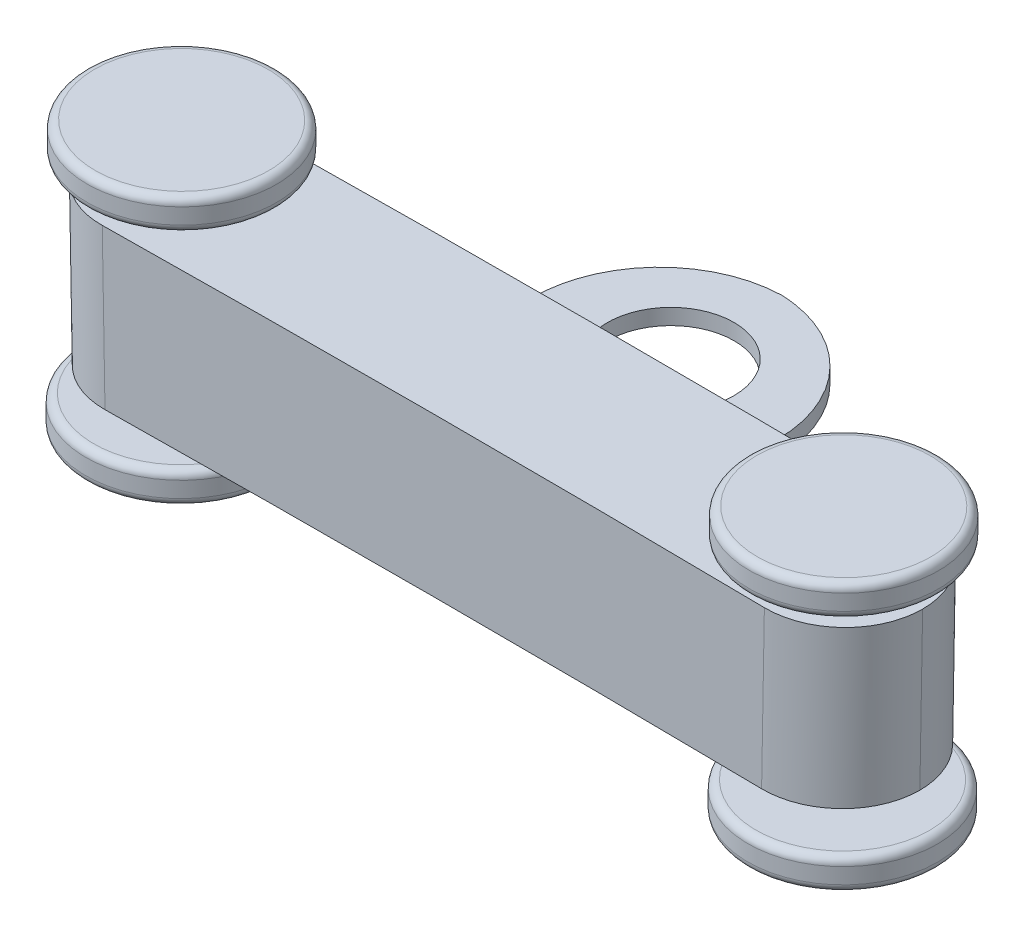
from build123d import *

# Parameters (mm, degrees)
EXTRUDE_1_DEPTH      = 5
FILLET_1_R           = 5
EXTRUDE_2_DEPTH      = 12
FILLET_2_R           = 8
SKETCH_4_R           = 4
CUT_EXTRUDE_1_DEPTH  = 1486.323382692
EXTRUDE_3_DEPTH      = 1
EXTRUDE_3_DEPTH_BACK = 12
SKETCH_5_R           = 2
SKETCH_6_R           = 6
EXTRUDE_4_DEPTH      = 2
EXTRUDE_START        = 2
SKETCH_7_R           = 6
EXTRUDE_5_DEPTH      = 2
FILLET_4_R           = 0.5


# Some blends are built 0.0001 mm under size
with BuildPart() as part:
    # 草图1 → 凸台-拉伸1 (new, symmetric)
    with BuildSketch(Plane.XY):
        with BuildLine():
            Line((-25.742299495, 1474.775350356), (-25.916823559, 1484.773827307))
            ThreePointArc((-25.916823559, 1484.773827307), (0, 1485), (25.916823559, 1484.773827307))
            Line((25.916823559, 1484.773827307), (25.742299495, 1474.775350356))
            ThreePointArc((25.742299495, 1474.775350356), (0, 1475), (-25.742299495, 1474.775350356))
        make_face()
    extrude(amount=EXTRUDE_1_DEPTH, both=True)

    # 圆角1
    fillet_1_edges = [part.edges().sort_by_distance(p)[0] for p in [
        (25.829561527, 1479.774588831, 5),
        (25.829561527, 1479.774588831, -5),
        (-25.829561527, 1479.774588831, 5),
        (-25.829561527, 1479.774588831, -5),
    ]]
    fillet(fillet_1_edges, radius=FILLET_1_R - 0.0001)  # a hair under: the kernel refuses the full size

    # 草图3 → 凸台-拉伸2 (add)
    with BuildSketch(Plane(origin=(0, 0, -5), x_dir=(-1, 0, 0), z_dir=(0, 0, -1))):
        with BuildLine():
            Line((-7.751844452, 1480.479705672), (-7.746608489, 1479.47971938))
            ThreePointArc((-7.746608489, 1479.47971938), (-3.873317518, 1479.494929836), (0, 1479.5))
            Line((0, 1479.5), (0, 1480.5))
            ThreePointArc((0, 1480.5), (-3.875935509, 1480.494926409), (-7.751844452, 1480.479705672))
        make_face()
        with BuildLine():
            Line((0, 1480.5), (0, 1479.5))
            ThreePointArc((0, 1479.5), (3.873317518, 1479.494929836), (7.746608489, 1479.47971938))
            Line((7.746608489, 1479.47971938), (7.751844452, 1480.479705672))
            ThreePointArc((7.751844452, 1480.479705672), (3.875935509, 1480.494926409), (0, 1480.5))
        make_face()
    extrude(amount=EXTRUDE_2_DEPTH)

    # 圆角2
    # the kernel refuses this fillet: 8 mm, written as the material it takes off along each edge
    with BuildSketch(Plane(origin=(-7.641889212, 1459.479993535, -17), x_dir=(0, 0, 1), z_dir=(-0.005235963831420343, 0.9999862922474269, 0)), Plane(origin=(7.856563729, 1500.479431517, -17), x_dir=(0, 0, 1), z_dir=(-0.0052359638314218165, -0.9999862922474269, 0))) as fillet_2_piece_1:
        with BuildLine():
            CenterArc((FILLET_2_R, FILLET_2_R), FILLET_2_R, 180, 90)
            Line((0, FILLET_2_R), (0, 0))
            Line((0, 0), (FILLET_2_R, 0))
        make_face()
    extrude(amount=41, mode=Mode.SUBTRACT)

    # 草图4 → 切除-拉伸1 (cut, through all)
    with BuildSketch(Plane(origin=(0, 0, 0), x_dir=(1, 0, 0), z_dir=(0, 1, 0))):
        with Locations(Location((0, 10, 0), (0, 0, 90))):
            Circle(SKETCH_4_R)
    extrude(amount=CUT_EXTRUDE_1_DEPTH, mode=Mode.SUBTRACT)

    # 草图5 → 凸台-拉伸3 (add, two sides: drawn at the far end of the back side and taken through both)
    with BuildSketch(Plane(origin=(7.77540629, 1484.979643987, 0), x_dir=(0.9999862922474269, -0.005235963831419459, 0), z_dir=(0.005235963831419459, 0.9999862922474269, 0)).offset(-EXTRUDE_3_DEPTH_BACK)):
        with Locations(Location((-28.691786338, 0, 0), (0, 0, 180))):
            Circle(SKETCH_5_R)
        with Locations(Location((13.142516555, 0, 0), (0, 0, 180))):
            Circle(SKETCH_5_R)
    extrude(amount=EXTRUDE_3_DEPTH + EXTRUDE_3_DEPTH_BACK)

    # 草图6 → 凸台-拉伸4 (add)
    with BuildSketch(Plane(origin=(7.780642253, 1485.97963028, 0), x_dir=(0.9999862922474269, -0.00523596383141946, 0), z_dir=(0.00523596383141946, 0.9999862922474269, 0))):
        with Locations(Location((-28.691786338, 0, 0), (0, 0, 180))):
            Circle(SKETCH_6_R)
        with Locations(Location((13.142516555, 0, 0), (0, 0, 180))):
            Circle(SKETCH_6_R)
    extrude(amount=EXTRUDE_4_DEPTH)

    # 草图7 → 凸台-拉伸5 (add)
    with BuildSketch(Plane(origin=(7.712574724, 1472.97980848, 0), x_dir=(0.9999862922474269, -0.00523596383141946, 0), z_dir=(-0.00523596383141946, -0.9999862922474269, 0)).offset(EXTRUDE_START)):
        with Locations(Location((-28.691786338, 0, 0), (0, 0, 180))):
            Circle(SKETCH_7_R)
        with Locations(Location((13.142516555, 0, 0), (0, 0, 180))):
            Circle(SKETCH_7_R)
    extrude(amount=-EXTRUDE_5_DEPTH)

    # 圆角4
    fillet_4_edges = [part.edges().sort_by_distance(p)[0] for p in [
        (-18.969638438, 1474.87801286, 2e-09),
        (-18.917270282, 1484.87950248, 2e-09),
        (-18.9107782, 1486.119387508, 0),
        (22.864948648, 1474.822767021, 2e-09),
        (22.917311027, 1484.823153394, 2e-09),
        (-14.910833031, 1486.098443652, 0),
        (-14.900361103, 1488.098416237, 0),
        (26.922896408, 1485.879400755, 0),
        (26.933368335, 1487.87937334, 0),
        (-14.978900561, 1473.098621853, 0),
        (-14.989372488, 1471.098649269, 0),
        (26.854828878, 1472.879578956, 0),
        (26.84435695, 1470.879606372, 0),
    ]]
    fillet(fillet_4_edges, radius=FILLET_4_R)


solid = part.part
